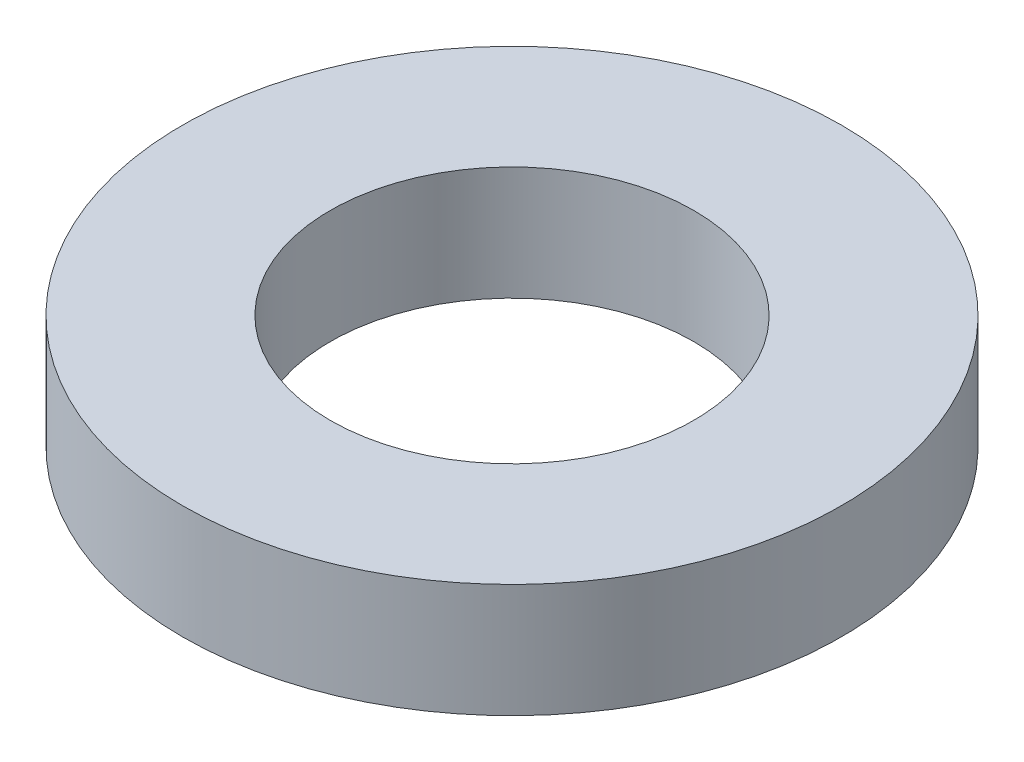
from build123d import *

# Parameters (mm, degrees)
SKETCH1_R           = 72.5
BOSS_EXTRUDE1_DEPTH = 25
SKETCH2_R           = 40
CUT_EXTRUDE1_DEPTH  = 106.534354596


with BuildPart() as part:
    # Sketch1 → Boss-Extrude1 (new body)
    with BuildSketch(Plane(origin=(0, 0, 0), x_dir=(1, 0, 0), z_dir=(0, 1, 0))):
        Circle(SKETCH1_R)
    extrude(amount=BOSS_EXTRUDE1_DEPTH)

    # Sketch2 → Cut-Extrude1 (cut, through all)
    with BuildSketch(Plane(origin=(0, 0, 0), x_dir=(1, 0, 0), z_dir=(0, 1, 0))):
        Circle(SKETCH2_R)
    extrude(amount=CUT_EXTRUDE1_DEPTH, mode=Mode.SUBTRACT)


solid = part.part
